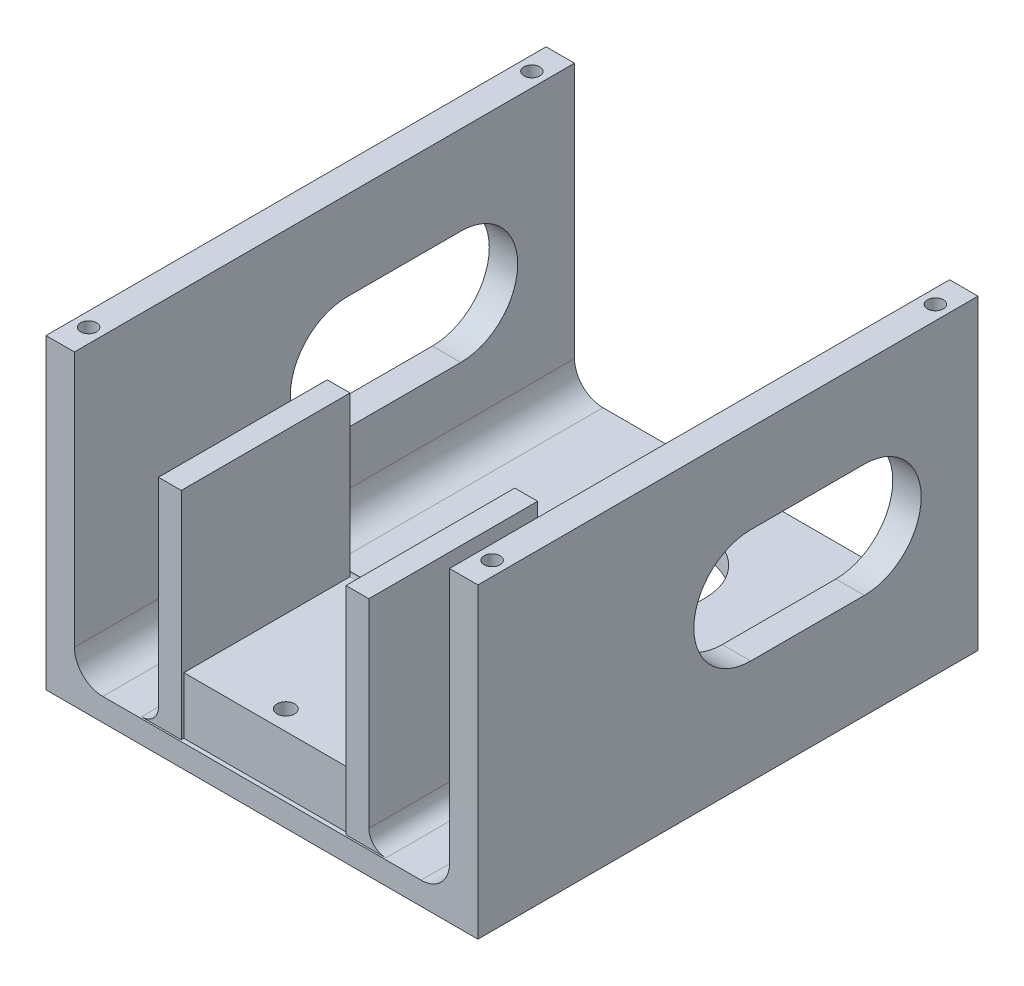
from build123d import *

# Parameters (mm, degrees)
SKETCH_6_W           = 28.99281841
SKETCH_6_H           = 28.951324053
EXTRUDE_2_DEPTH      = 10
SKETCH_8_W           = 76
SKETCH_8_H           = 88
EXTRUDE_3_DEPTH      = 4
SKETCH_4_R           = 1.55
CUT_EXTRUDE_2_DEPTH  = 15
SKETCH_5_R           = 1.55
CUT_EXTRUDE_3_DEPTH  = 15
SKETCH_10_W          = 4.022554567
SKETCH_10_H          = 29.702617941
EXTRUDE_9_DEPTH      = 38
SKETCH_11_W          = 4.010171553
SKETCH_11_H          = 29.702617961
EXTRUDE_10_DEPTH     = 38
SKETCH_14_W          = 5
SKETCH_14_H          = 88
EXTRUDE_14_DEPTH     = 50
SKETCH_15_W          = 5
SKETCH_15_H          = 88
EXTRUDE_15_DEPTH     = 50
SKETCH_19_R          = 2.6
CUT_EXTRUDE_5_DEPTH  = 3
SKETCH_18_R          = 2.598478488
CUT_EXTRUDE_6_DEPTH  = 3
SKETCH_21_R          = 1.4
CUT_EXTRUDE_8_DEPTH  = 8
CUT_EXTRUDE_9_DEPTH  = 80
CUT_EXTRUDE_11_DEPTH = 80
FILLET_1_R           = 5
FILLET_2_R           = 5
SKETCH_24_W          = 28.984243656
SKETCH_24_H          = 0.299988544
EXTRUDE_16_DEPTH     = 10
SKETCH_25_W          = 37.016969776
SKETCH_25_H          = 2
EXTRUDE_18_DEPTH     = 10
FILLET_7_R           = 2
FILLET_8_R           = 3
FILLET_9_R           = 3
FILLET_10_R          = 3


with BuildPart() as part:
    # 草图6 → 凸台-拉伸2 (new body)
    with BuildSketch(Plane.XZ.offset(14.4)):
        with Locations((0.000972868, 14.775650571)):
            Rectangle(SKETCH_6_W, SKETCH_6_H)
    extrude(amount=EXTRUDE_2_DEPTH)

    # 草图8 → 凸台-拉伸3 (add)
    with BuildSketch(Plane.XZ.offset(24.4)):
        with Locations((1e-09, -13.999999049)):
            Rectangle(SKETCH_8_W, SKETCH_8_H)
    extrude(amount=EXTRUDE_3_DEPTH)

    # 草图4 → 切除-拉伸2 (cut)
    with BuildSketch(Plane.XZ.offset(14.4)):
        with Locations((-10, 2.1)):
            Circle(SKETCH_4_R)
        with Locations((10, 2.1)):
            Circle(SKETCH_4_R)
    extrude(amount=CUT_EXTRUDE_2_DEPTH, mode=Mode.SUBTRACT)

    # 草图5 → 切除-拉伸3 (cut)
    with BuildSketch(Plane.XZ.offset(14.4)):
        with Locations((0, 25.8)):
            Circle(SKETCH_5_R)
    extrude(amount=CUT_EXTRUDE_3_DEPTH, mode=Mode.SUBTRACT)

    # 草图10 → 凸台-拉伸9 (add)
    with BuildSketch(Plane(origin=(0, -24.4, 0), x_dir=(1, 0, 0), z_dir=(0, 1, 0))):
        with Locations((16.503397967, -14.851308971)):
            Rectangle(SKETCH_10_W, SKETCH_10_H)
    extrude(amount=EXTRUDE_9_DEPTH)

    # 草图11 → 凸台-拉伸10 (add)
    with BuildSketch(Plane(origin=(0, -24.4, 0), x_dir=(1, 0, 0), z_dir=(0, 1, 0))):
        with Locations((-16.497208749, -14.851308981)):
            Rectangle(SKETCH_11_W, SKETCH_11_H)
    extrude(amount=EXTRUDE_10_DEPTH)

    # 草图14 → 凸台-拉伸14 (add)
    with BuildSketch(Plane(origin=(0, -24.4, 0), x_dir=(1, 0, 0), z_dir=(0, 1, 0))):
        with Locations((-35.499999999, 13.999999049)):
            Rectangle(SKETCH_14_W, SKETCH_14_H)
    extrude(amount=EXTRUDE_14_DEPTH)

    # 草图15 → 凸台-拉伸15 (add)
    with BuildSketch(Plane(origin=(0, -24.4, 0), x_dir=(1, 0, 0), z_dir=(0, 1, 0))):
        with Locations((35.500000001, 13.999999049)):
            Rectangle(SKETCH_15_W, SKETCH_15_H)
    extrude(amount=EXTRUDE_15_DEPTH)

    # 草图19 → 切除-拉伸5 (cut)
    with BuildSketch(Plane.XZ.offset(28.4)):
        with Locations((-10, 2.1)):
            Circle(SKETCH_19_R)
        with Locations((10, 2.1)):
            Circle(SKETCH_19_R)
    extrude(amount=-CUT_EXTRUDE_5_DEPTH, mode=Mode.SUBTRACT)

    # 草图18 → 切除-拉伸6 (cut)
    with BuildSketch(Plane.XZ.offset(28.4)):
        with Locations((0, 25.8)):
            Circle(SKETCH_18_R)
    extrude(amount=-CUT_EXTRUDE_6_DEPTH, mode=Mode.SUBTRACT)

    # 草图21 → 切除-拉伸8 (cut)
    with BuildSketch(Plane(origin=(0, 25.6, 0), x_dir=(1, 0, 0), z_dir=(0, 1, 0))):
        with Locations((-35.499999999, 52.999999049)):
            Circle(SKETCH_21_R)
        with Locations((-35.499999999, -25.000000951)):
            Circle(SKETCH_21_R)
        with Locations((35.500000001, 52.999999049)):
            Circle(SKETCH_21_R)
        with Locations((35.500000001, -25.000000951)):
            Circle(SKETCH_21_R)
    extrude(amount=-CUT_EXTRUDE_8_DEPTH, mode=Mode.SUBTRACT)

    # 草图22 → 切除-拉伸9 (cut)
    with BuildSketch(Plane.ZY.offset(37.999999999)):
        with BuildLine():
            Line((-37.999999049, 10), (-17.999999049, 10))
            ThreePointArc((-17.999999049, 10), (-7.999999049, 0), (-17.999999049, -10))
            Line((-17.999999049, -10), (-37.999999049, -10))
            ThreePointArc((-37.999999049, -10), (-47.999999049, 0), (-37.999999049, 10))
        make_face()
    extrude(amount=-CUT_EXTRUDE_9_DEPTH, mode=Mode.SUBTRACT)

    # 草图23 → 切除-拉伸11 (cut)
    with BuildSketch(Plane(origin=(0, -24.4, 0), x_dir=(1, 0, 0), z_dir=(0, 1, 0))):
        with BuildLine():
            Line((10, 37.999999049), (10, 17.999999049))
            ThreePointArc((10, 17.999999049), (0, 7.999999049), (-10, 17.999999049))
            Line((-10, 17.999999049), (-10, 37.999999049))
            ThreePointArc((-10, 37.999999049), (0, 47.999999049), (10, 37.999999049))
        make_face()
    extrude(amount=-CUT_EXTRUDE_11_DEPTH, mode=Mode.SUBTRACT)

    # 圆角1
    fillet_1_edges = [part.edges().sort_by_distance(p)[0] for p in [
        (-32.999999999, -24.4, -13.999999049),
    ]]
    fillet(fillet_1_edges, radius=FILLET_1_R)

    # 圆角2
    fillet_2_edges = [part.edges().sort_by_distance(p)[0] for p in [
        (33.000000001, -24.4, -13.999999049),
    ]]
    fillet(fillet_2_edges, radius=FILLET_2_R)

    # 草图24 → 凸台-拉伸16 (add)
    with BuildSketch(Plane(origin=(0, -24.4, 0), x_dir=(1, 0, 0), z_dir=(0, 1, 0))):
        with Locations((-1.144e-06, -0.149994272)):
            Rectangle(SKETCH_24_W, SKETCH_24_H)
    extrude(amount=EXTRUDE_16_DEPTH)

    # 草图25 → 凸台-拉伸18 (add)
    with BuildSketch(Plane(origin=(0, -24.4, 0), x_dir=(1, 0, 0), z_dir=(0, 1, 0))):
        with Locations((0.006190363, 1)):
            Rectangle(SKETCH_25_W, SKETCH_25_H)
    extrude(amount=EXTRUDE_18_DEPTH)

    # 圆角7
    fillet_7_edges = [part.edges().sort_by_distance(p)[0] for p in [
        (0.006190363, -14.4, -2),
    ]]
    fillet(fillet_7_edges, radius=FILLET_7_R)

    # 圆角8
    fillet_8_edges = [part.edges().sort_by_distance(p)[0] for p in [
        (18.514675251, -24.4, 13.85130897),
    ]]
    fillet(fillet_8_edges, radius=FILLET_8_R)

    # 圆角9
    fillet_9_edges = [part.edges().sort_by_distance(p)[0] for p in [
        (1.506190363, -24.4, -2),
    ]]
    fillet(fillet_9_edges, radius=FILLET_9_R)

    # 圆角10
    fillet_10_edges = [part.edges().sort_by_distance(p)[0] for p in [
        (-18.502294525, -24.4, 12.35130898),
    ]]
    fillet(fillet_10_edges, radius=FILLET_10_R)


solid = part.part
